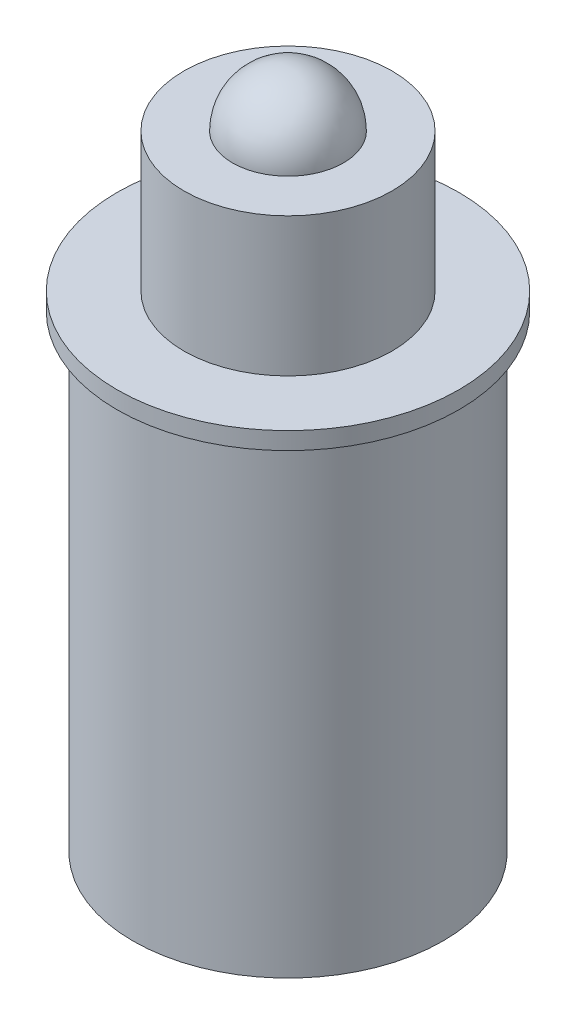
from build123d import *

# Parameters (mm, degrees)
SKETCH1_R           = 2.235
BOSS_EXTRUDE1_DEPTH = 6.75
SKETCH2_R           = 2.465
BOSS_EXTRUDE2_DEPTH = 0.25
SKETCH4_R           = 1.5
BOSS_EXTRUDE3_DEPTH = 2
SKETCH5_R           = 0.8
BOSS_EXTRUDE4_DEPTH = 0.8
FILLET1_R           = 0.8


with BuildPart() as part:
    # Sketch1 → Boss-Extrude1 (new body)
    with BuildSketch(Plane(origin=(0, 0, 0), x_dir=(1, 0, 0), z_dir=(0, 1, 0))):
        with Locations(Location((0, 0, 0), (0, 0, 270))):
            Circle(SKETCH1_R)
    extrude(amount=BOSS_EXTRUDE1_DEPTH)

    # Sketch2 → Boss-Extrude2 (add)
    with BuildSketch(Plane(origin=(0, 6.75, 0), x_dir=(1, 0, 0), z_dir=(0, 1, 0))):
        with Locations(Location((0, 0, 0), (0, 0, 270))):
            Circle(SKETCH2_R)
    extrude(amount=BOSS_EXTRUDE2_DEPTH)

    # Sketch4 → Boss-Extrude3 (add)
    with BuildSketch(Plane(origin=(0, 7, 0), x_dir=(1, 0, 0), z_dir=(0, 1, 0))):
        with Locations(Location((0, 0, 0), (0, 0, 270))):
            Circle(SKETCH4_R)
    extrude(amount=BOSS_EXTRUDE3_DEPTH)

    # Sketch5 → Boss-Extrude4 (add)
    with BuildSketch(Plane(origin=(0, 9, 0), x_dir=(1, 0, 0), z_dir=(0, 1, 0))):
        with Locations(Location((0, 0, 0), (0, 0, 270))):
            Circle(SKETCH5_R)
    extrude(amount=BOSS_EXTRUDE4_DEPTH)

    # Fillet1
    fillet1_edges = [part.edges().sort_by_distance(p)[0] for p in [
        (0, 9.8, -0.8),
    ]]
    fillet(fillet1_edges, radius=FILLET1_R - 0.0001)  # a hair under: the kernel refuses the full size


solid = part.part
